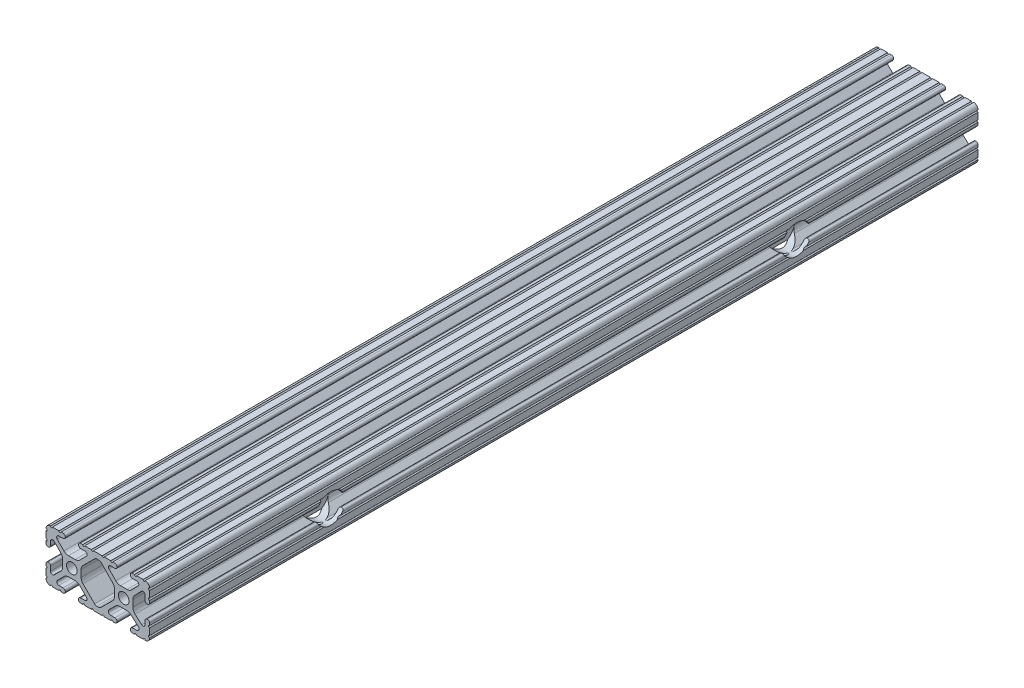
from build123d import *

# Parameters (mm, degrees)
SKETCH1_R                                            = 2.6035
BOSS_EXTRUDE1_DEPTH                                  = 203.2
CBORE_FOR_1_4_BINDING_HEAD_MACHINE_SCREW_D           = 6.7564
CBORE_FOR_1_4_BINDING_HEAD_MACHINE_SCREW_CBORE_D     = 14.2875
CBORE_FOR_1_4_BINDING_HEAD_MACHINE_SCREW_CBORE_DEPTH = 8.255
F_1_4_0_25_DIAMETER_HOLE1_D                          = 6.35


with BuildPart() as part:
    # Sketch1 → Boss-Extrude1 (new, symmetric)
    with BuildSketch(Plane.XY):
        with BuildLine():
            Line((18.01710265, 12.7), (16.98745015, 12.7))
            ThreePointArc((16.98745015, 12.7), (16.245730386, 12.392769614), (15.9385, 11.65104985))
            Line((15.9385, 11.65104985), (15.9385, 11.53922))
            ThreePointArc((15.9385, 11.53922), (16.245750844, 10.797450844), (16.98752, 10.4902))
            Line((16.98752, 10.4902), (19.116384363, 10.4902))
            ThreePointArc((19.116384363, 10.4902), (20.052502933, 9.869096983), (19.844087081, 8.765172272))
            Line((19.844087081, 8.765172272), (16.618993479, 5.455112286))
            ThreePointArc((16.618993479, 5.455112286), (15.578994274, 4.745442459), (14.344932584, 4.4958))
            Line((14.344932584, 4.4958), (11.083317835, 4.4958))
            ThreePointArc((11.083317835, 4.4958), (9.854330953, 4.743306833), (8.816955189, 5.447238587))
            Line((8.816955189, 5.447238587), (5.564154119, 8.762652677))
            ThreePointArc((5.564154119, 8.762652677), (5.352591412, 9.867473037), (6.289393385, 10.4902))
            Line((6.289393385, 10.4902), (8.41248, 10.4902))
            ThreePointArc((8.41248, 10.4902), (9.154249156, 10.797450844), (9.4615, 11.53922))
            Line((9.4615, 11.53922), (9.4615, 11.65104985))
            ThreePointArc((9.4615, 11.65104985), (9.154269614, 12.392769614), (8.41254985, 12.7))
            Line((8.41254985, 12.7), (7.38288465, 12.7))
            ThreePointArc((7.38288465, 12.7), (6.87488465, 12.192), (6.36688465, 12.7))
            Line((6.36688465, 12.7), (3.14958095, 12.7))
            ThreePointArc((3.14958095, 12.7), (2.64158095, 12.192), (2.13358095, 12.7))
            Line((2.13358095, 12.7), (-2.13358095, 12.7))
            ThreePointArc((-2.13358095, 12.7), (-2.64158095, 12.192), (-3.14958095, 12.7))
            Line((-3.14958095, 12.7), (-6.36689735, 12.7))
            ThreePointArc((-6.36689735, 12.7), (-6.87489735, 12.192), (-7.38289735, 12.7))
            Line((-7.38289735, 12.7), (-8.41254985, 12.7))
            ThreePointArc((-8.41254985, 12.7), (-9.154269614, 12.392769614), (-9.4615, 11.65104985))
            Line((-9.4615, 11.65104985), (-9.4615, 11.53922))
            ThreePointArc((-9.4615, 11.53922), (-9.154249156, 10.797450844), (-8.41248, 10.4902))
            Line((-8.41248, 10.4902), (-6.283641037, 10.4902))
            ThreePointArc((-6.283641037, 10.4902), (-5.297291557, 9.829633109), (-5.532576693, 8.666071843))
            Line((-5.532576693, 8.666071843), (-8.809985098, 5.416263103))
            ThreePointArc((-8.809985098, 5.416263103), (-9.836720513, 4.734920264), (-11.045536121, 4.4958))
            Line((-11.045536121, 4.4958), (-14.354463879, 4.4958))
            ThreePointArc((-14.354463879, 4.4958), (-15.563279487, 4.734920264), (-16.590014902, 5.416263103))
            Line((-16.590014902, 5.416263103), (-19.867423307, 8.666071843))
            ThreePointArc((-19.867423307, 8.666071843), (-20.102708443, 9.829633109), (-19.116358963, 10.4902))
            Line((-19.116358963, 10.4902), (-16.98752, 10.4902))
            ThreePointArc((-16.98752, 10.4902), (-16.245750844, 10.797450844), (-15.9385, 11.53922))
            Line((-15.9385, 11.53922), (-15.9385, 11.65104985))
            ThreePointArc((-15.9385, 11.65104985), (-16.245730386, 12.392769614), (-16.98745015, 12.7))
            Line((-16.98745015, 12.7), (-18.01711535, 12.7))
            ThreePointArc((-18.01711535, 12.7), (-18.52511535, 12.192), (-19.03311535, 12.7))
            Line((-19.03311535, 12.7), (-22.2504, 12.7))
            ThreePointArc((-22.2504, 12.7), (-22.758323491, 12.192000006), (-23.266399977, 12.699846982))
            ThreePointArc((-23.266399977, 12.699846982), (-24.782522516, 12.082522516), (-25.399846982, 10.566399977))
            ThreePointArc((-25.399846982, 10.566399977), (-24.892000006, 10.058323491), (-25.4, 9.5504))
            Line((-25.4, 9.5504), (-25.4, 6.3330836))
            ThreePointArc((-25.4, 6.3330836), (-24.892, 5.8250836), (-25.4, 5.3170836))
            Line((-25.4, 5.3170836), (-25.4, 4.237520184))
            ThreePointArc((-25.4, 4.237520184), (-25.107393763, 3.531106237), (-24.400979816, 3.2385))
            Line((-24.400979816, 3.2385), (-24.23922, 3.2385))
            ThreePointArc((-24.23922, 3.2385), (-23.497450844, 3.545750844), (-23.1902, 4.28752))
            Line((-23.1902, 4.28752), (-23.1902, 6.334741132))
            ThreePointArc((-23.1902, 6.334741132), (-22.556026952, 7.286023527), (-21.434002553, 7.066535717))
            Line((-21.434002553, 7.066535717), (-18.147950853, 3.808156468))
            ThreePointArc((-18.147950853, 3.808156468), (-17.452759693, 2.774838327), (-17.208501877, 1.553619571))
            Line((-17.208501877, 1.553619571), (-17.208501877, -1.695179196))
            ThreePointArc((-17.208501877, -1.695179196), (-17.450738657, -2.911536421), (-18.140486065, -3.942289578))
            Line((-18.140486065, -3.942289578), (-21.431579576, -7.227386226))
            ThreePointArc((-21.431579576, -7.227386226), (-22.55444896, -7.449940594), (-23.1902, -6.498002195))
            Line((-23.1902, -6.498002195), (-23.1902, -4.28752))
            ThreePointArc((-23.1902, -4.28752), (-23.497450844, -3.545750844), (-24.23922, -3.2385))
            Line((-24.23922, -3.2385), (-24.35098, -3.2385))
            ThreePointArc((-24.35098, -3.2385), (-25.092749156, -3.545750844), (-25.4, -4.28752))
            Line((-25.4, -4.28752), (-25.4, -5.3171344))
            ThreePointArc((-25.4, -5.3171344), (-24.892, -5.8251344), (-25.4, -6.3331344))
            Line((-25.4, -6.3331344), (-25.4, -9.5504))
            ThreePointArc((-25.4, -9.5504), (-24.892000006, -10.058323491), (-25.399846982, -10.566399977))
            ThreePointArc((-25.399846982, -10.566399977), (-24.782522516, -12.082522516), (-23.266399977, -12.699846982))
            ThreePointArc((-23.266399977, -12.699846982), (-22.758323491, -12.192000006), (-22.2504, -12.7))
            Line((-22.2504, -12.7), (-19.03308995, -12.7))
            ThreePointArc((-19.03308995, -12.7), (-18.52508995, -12.192), (-18.01708995, -12.7))
            Line((-18.01708995, -12.7), (-16.9874692, -12.7))
            ThreePointArc((-16.9874692, -12.7), (-16.245700044, -12.392749156), (-15.9384492, -11.65098))
            Line((-15.9384492, -11.65098), (-15.9384492, -11.53922))
            ThreePointArc((-15.9384492, -11.53922), (-16.245700044, -10.797450844), (-16.9874692, -10.4902))
            Line((-16.9874692, -10.4902), (-19.116358963, -10.4902))
            ThreePointArc((-19.116358963, -10.4902), (-20.055197748, -9.862578342), (-19.834124023, -8.755124678))
            Line((-19.834124023, -8.755124678), (-16.49660751, -5.423689618))
            ThreePointArc((-16.49660751, -5.423689618), (-15.467274017, -4.736928798), (-14.253591699, -4.4958))
            Line((-14.253591699, -4.4958), (-11.146408301, -4.4958))
            ThreePointArc((-11.146408301, -4.4958), (-9.932725983, -4.736928798), (-8.90339249, -5.423689618))
            Line((-8.90339249, -5.423689618), (-5.565875977, -8.755124678))
            ThreePointArc((-5.565875977, -8.755124678), (-5.344802252, -9.862578342), (-6.283641037, -10.4902))
            Line((-6.283641037, -10.4902), (-8.4125308, -10.4902))
            ThreePointArc((-8.4125308, -10.4902), (-9.154299956, -10.797450844), (-9.4615508, -11.53922))
            Line((-9.4615508, -11.53922), (-9.4615508, -11.65098))
            ThreePointArc((-9.4615508, -11.65098), (-9.154299956, -12.392749156), (-8.4125308, -12.7))
            Line((-8.4125308, -12.7), (-7.38287195, -12.7))
            ThreePointArc((-7.38287195, -12.7), (-6.87487195, -12.192), (-6.36687195, -12.7))
            Line((-6.36687195, -12.7), (-3.14960635, -12.7))
            ThreePointArc((-3.14960635, -12.7), (-2.64160635, -12.192), (-2.13360635, -12.7))
            Line((-2.13360635, -12.7), (2.13360635, -12.7))
            ThreePointArc((2.13360635, -12.7), (2.64159365, -12.1920127), (3.14958095, -12.7))
            Line((3.14958095, -12.7), (6.36691005, -12.7))
            ThreePointArc((6.36691005, -12.7), (6.87491005, -12.192), (7.38291005, -12.7))
            Line((7.38291005, -12.7), (8.4125308, -12.7))
            ThreePointArc((8.4125308, -12.7), (9.154299956, -12.392749156), (9.4615508, -11.65098))
            Line((9.4615508, -11.65098), (9.4615508, -11.53922))
            ThreePointArc((9.4615508, -11.53922), (9.154299956, -10.797450844), (8.4125308, -10.4902))
            Line((8.4125308, -10.4902), (6.289393385, -10.4902))
            ThreePointArc((6.289393385, -10.4902), (5.231590322, -9.783049717), (5.480677245, -8.535265862))
            Line((5.480677245, -8.535265862), (8.597933595, -5.423689618))
            ThreePointArc((8.597933595, -5.423689618), (9.627267088, -4.736928798), (10.840949406, -4.4958))
            Line((10.840949406, -4.4958), (14.102564155, -4.4958))
            ThreePointArc((14.102564155, -4.4958), (15.215927525, -4.697410182), (16.187895372, -5.276636531))
            Line((16.187895372, -5.276636531), (19.868247549, -8.482246082))
            ThreePointArc((19.868247549, -8.482246082), (20.188435806, -9.746879864), (19.116384363, -10.4902))
            Line((19.116384363, -10.4902), (16.9874692, -10.4902))
            ThreePointArc((16.9874692, -10.4902), (16.245700044, -10.797450844), (15.9384492, -11.53922))
            Line((15.9384492, -11.53922), (15.9384492, -11.65098))
            ThreePointArc((15.9384492, -11.65098), (16.245700044, -12.392749156), (16.9874692, -12.7))
            Line((16.9874692, -12.7), (18.01710265, -12.7))
            ThreePointArc((18.01710265, -12.7), (18.52510265, -12.192), (19.03310265, -12.7))
            Line((19.03310265, -12.7), (22.2504, -12.7))
            ThreePointArc((22.2504, -12.7), (22.758323491, -12.192000006), (23.266399977, -12.699846982))
            ThreePointArc((23.266399977, -12.699846982), (24.782522516, -12.082522516), (25.399846982, -10.566399977))
            ThreePointArc((25.399846982, -10.566399977), (24.892000006, -10.058323492), (25.4, -9.550400001))
            Line((25.4, -9.550400001), (25.4, -6.333083592))
            ThreePointArc((25.4, -6.333083592), (24.892000001, -5.825083593), (25.4, -5.317083593))
            Line((25.4, -5.317083593), (25.4, -4.237520184))
            ThreePointArc((25.4, -4.237520184), (25.107393763, -3.531106237), (24.400979816, -3.2385))
            Line((24.400979816, -3.2385), (24.189220184, -3.2385))
            ThreePointArc((24.189220184, -3.2385), (23.482806237, -3.531106237), (23.1902, -4.237520184))
            Line((23.1902, -4.237520184), (23.1902, -6.155876159))
            ThreePointArc((23.1902, -6.155876159), (22.62232736, -7.038258539), (21.583974541, -6.886926384))
            Line((21.583974541, -6.886926384), (18.29817066, -4.024970844))
            ThreePointArc((18.29817066, -4.024970844), (17.493730985, -2.946044689), (17.208501877, -1.630807374))
            Line((17.208501877, -1.630807374), (17.208501877, 1.630807374))
            ThreePointArc((17.208501877, 1.630807374), (17.442348332, 2.82673414), (18.109440981, 3.846495088))
            Line((18.109440981, 3.846495088), (21.526346532, 7.353420386))
            ThreePointArc((21.526346532, 7.353420386), (22.585896263, 7.574939077), (23.1902, 6.676867167))
            Line((23.1902, 6.676867167), (23.1902, 4.237520184))
            ThreePointArc((23.1902, 4.237520184), (23.482806237, 3.531106237), (24.189220184, 3.2385))
            Line((24.189220184, 3.2385), (24.400979816, 3.2385))
            ThreePointArc((24.400979816, 3.2385), (25.107393763, 3.531106237), (25.4, 4.237520184))
            Line((25.4, 4.237520184), (25.4, 5.3170836))
            ThreePointArc((25.4, 5.3170836), (24.891949193, 5.825134407), (25.4, 6.333185215))
            Line((25.4, 6.333185215), (25.4, 9.550400015))
            ThreePointArc((25.4, 9.550400015), (24.892000013, 10.058323498), (25.399846982, 10.566399977))
            ThreePointArc((25.399846982, 10.566399977), (24.782522516, 12.082522516), (23.266399977, 12.699846982))
            ThreePointArc((23.266399977, 12.699846982), (22.758323491, 12.192000006), (22.2504, 12.7))
            Line((22.2504, 12.7), (19.03310265, 12.7))
            ThreePointArc((19.03310265, 12.7), (18.52510265, 12.192), (18.01710265, 12.7))
        make_face()
        with Locations((-12.7, 0)):
            Circle(SKETCH1_R, mode=Mode.SUBTRACT)
        with Locations((12.7, 0)):
            Circle(SKETCH1_R, mode=Mode.SUBTRACT)
        with BuildLine():
            Line((-7.259513935, -3.869413038), (-1.545748891, -9.572766749))
            ThreePointArc((-1.545748891, -9.572766749), (-1.035199478, -9.913400116), (-0.433213048, -10.033))
            Line((-0.433213048, -10.033), (0.433213048, -10.033))
            ThreePointArc((0.433213048, -10.033), (1.035199478, -9.913400116), (1.545748891, -9.572766749))
            Line((1.545748891, -9.572766749), (7.259513935, -3.869413038))
            ThreePointArc((7.259513935, -3.869413038), (7.949261343, -2.838659881), (8.191498123, -1.622302656))
            Line((8.191498123, -1.622302656), (8.191498123, 1.622302656))
            ThreePointArc((8.191498123, 1.622302656), (7.955573352, 2.823327967), (7.282860769, 3.845864069))
            Line((7.282860769, 3.845864069), (1.675572808, 9.561086461))
            ThreePointArc((1.675572808, 9.561086461), (1.161034429, 9.910236611), (0.551456936, 10.033))
            Line((0.551456936, 10.033), (-0.395199982, 10.033))
            ThreePointArc((-0.395199982, 10.033), (-0.994772524, 9.914396349), (-1.50403329, 9.576450301))
            Line((-1.50403329, 9.576450301), (-7.252049147, 3.876839553))
            ThreePointArc((-7.252049147, 3.876839553), (-7.947240307, 2.843521412), (-8.191498123, 1.622302656))
            Line((-8.191498123, 1.622302656), (-8.191498123, -1.622302656))
            ThreePointArc((-8.191498123, -1.622302656), (-7.949261343, -2.838659881), (-7.259513935, -3.869413038))
        make_face(mode=Mode.SUBTRACT)
    extrude(amount=BOSS_EXTRUDE1_DEPTH, both=True)

    # CBORE for 1/4 Binding Head Machine Screw1 (through all)
    with Locations(Plane(origin=(25.4, 0, 0), x_dir=(0, 0, -1), z_dir=(1, 0, 0))):
        with Locations((-114.3, 0), (114.3, 0)):
            CounterBoreHole(CBORE_FOR_1_4_BINDING_HEAD_MACHINE_SCREW_D / 2, CBORE_FOR_1_4_BINDING_HEAD_MACHINE_SCREW_CBORE_D / 2, CBORE_FOR_1_4_BINDING_HEAD_MACHINE_SCREW_CBORE_DEPTH)

    # 1/4 (0.25) Diameter Hole1 (through all)
    with Locations(Plane(origin=(25.4, 0, 0), x_dir=(0, 0, -1), z_dir=(1, 0, 0))):
        with Locations((-76.2, 0), (76.2, 0)):
            Hole(F_1_4_0_25_DIAMETER_HOLE1_D / 2)


solid = part.part
